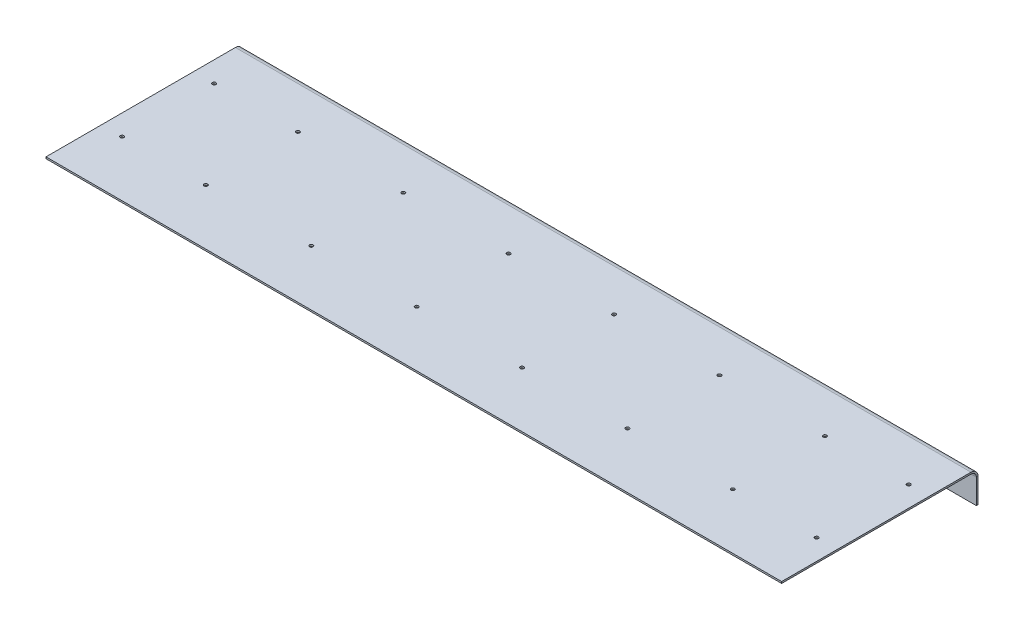
from build123d import *

# Parameters (mm, degrees)
CROQUIS1_W                       = 1396
CROQUIS1_H                       = 392.64
BRIDA_BASE1_DEPTH                = 3.175
TALADRO_DE_MARGEN_PARA_1_41_D    = 6.7564
BRIDA_DE_ARISTA1_STRIP_W         = 32.7
BRIDA_DE_ARISTA1_STRIP_H         = 3.175
BRIDA_DE_ARISTA1_STRIP_CUT_DEPTH = 1396
BRIDA_DE_ARISTA1_DEPTH           = 1396
TALADRO_DE_MARGEN_PARA_1_42_D    = 6.7564
CROQUIS9_W                       = 1396
CROQUIS9_H                       = 20
CORTAR_EXTRUIR1_DEPTH            = 10


# Sheet-metal steps are written as plain solids
with BuildPart() as part:
    # Croquis1 → Brida base1 (new body)
    with BuildSketch(Plane(origin=(0, 0, 0), x_dir=(1, 0, 0), z_dir=(0, 1, 0))):
        with Locations((-11.780590717, 232.198987342)):
            Rectangle(CROQUIS1_W, CROQUIS1_H)
    extrude(amount=-BRIDA_BASE1_DEPTH)

    # Taladro de margen para 1/41 (through all)
    with Locations(Plane(origin=(0, -3.175, 0), x_dir=(-1, 0, 0), z_dir=(0, -1, 0))):
        with Locations((511.780590717, 161.278987342), (511.780590717, 335.878987342), (311.780590717, 161.278987342), (311.780590717, 335.878987342), (111.780590717, 161.278987342), (111.780590717, 335.878987342), (-88.219409283, 161.278987342), (-88.219409283, 335.878987342), (-288.219409283, 161.278987342), (-288.219409283, 335.878987342), (-488.219409283, 161.278987342), (-488.219409283, 335.878987342), (670.780590717, 161.278987342), (670.780590717, 335.878987342), (-647.219409283, 161.278987342), (-647.219409283, 335.878987342)):
            Hole(TALADRO_DE_MARGEN_PARA_1_41_D / 2)

    # Brida de arista1 strip (across the edge) → Brida de arista1 strip cut (cut)
    with BuildSketch(Plane(origin=(-709.780590717, -3.175, -428.518987342), x_dir=(0, 0, 1), z_dir=(1, 0, 0))):
        with Locations((-3.175, -1.5875)):
            Rectangle(BRIDA_DE_ARISTA1_STRIP_W, BRIDA_DE_ARISTA1_STRIP_H)
    extrude(amount=BRIDA_DE_ARISTA1_STRIP_CUT_DEPTH, mode=Mode.SUBTRACT)

    # Brida de arista1 section (across the edge) → Brida de arista1 (add)
    with BuildSketch(Plane(origin=(-709.780590717, -3.175, -428.518987342), x_dir=(0, 0, 1), z_dir=(1, 0, 0))):
        with BuildLine():
            Line((0, 10), (0, 56.825))
            Line((0, 56.825), (3.175, 56.825))
            Line((3.175, 56.825), (3.175, 10))
            ThreePointArc((3.175, 10), (6.103932188, 2.928932188), (13.175, 0))
            Line((13.175, 0), (13.175, -3.175))
            ThreePointArc((13.175, -3.175), (3.858868158, 0.683868158), (0, 10))
        make_face()
    extrude(amount=BRIDA_DE_ARISTA1_DEPTH)

    # Taladro de margen para 1/42 (through all)
    with Locations(Plane.XY.offset(-425.343987342)):
        with Locations((-425.550590717, -32.4), (-260.180590717, -32.4), (-94.810590717, -32.4), (70.559409283, -32.4), (235.929409283, -32.4), (401.299409283, -32.4)):
            Hole(TALADRO_DE_MARGEN_PARA_1_42_D / 2)

    # Croquis9 → Cortar-Extruir1 (cut)
    with BuildSketch(Plane(origin=(0, -3.175, 0), x_dir=(-1, 0, 0), z_dir=(0, -1, 0))):
        with Locations((11.780590717, 45.878987342)):
            Rectangle(CROQUIS9_W, CROQUIS9_H)
    extrude(amount=-CORTAR_EXTRUIR1_DEPTH, mode=Mode.SUBTRACT)


solid = part.part
